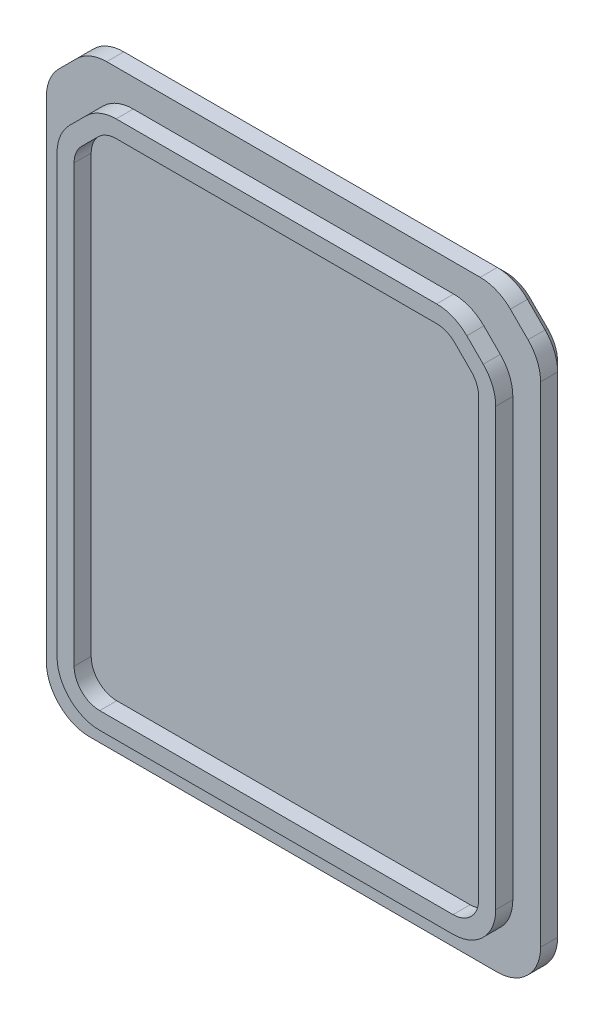
from build123d import *

# Parameters (mm, degrees)
BOSS_EXTRUDE1_DEPTH = 3
BOSS_EXTRUDE2_DEPTH = 2
CHAMFER1_SIZE       = 1
FILLET1_R           = 3
FILLET2_R           = 5


with BuildPart() as part:
    # Sketch2 → Boss-Extrude1 (new body)
    with BuildSketch(Plane(origin=(0, 0, -21.645), x_dir=(-1, 0, 0), z_dir=(0, 0, -1))):
        with BuildLine():
            Line((21.428932188, 45.48), (-22.307932188, 45.48))
            ThreePointArc((-22.307932188, 45.48), (-24.22134935, 45.099397663), (-25.843466094, 44.015533906))
            Line((-25.843466094, 44.015533906), (-27.914533906, 41.944466094))
            ThreePointArc((-27.914533906, 41.944466094), (-28.998397663, 40.32234935), (-29.379, 38.408932188))
            Line((-29.379, 38.408932188), (-29.379, -18.928932188))
            ThreePointArc((-29.379, -18.928932188), (-28.998397663, -20.84234935), (-27.914533906, -22.464466094))
            Line((-27.914533906, -22.464466094), (-27.843466094, -22.535533906))
            ThreePointArc((-27.843466094, -22.535533906), (-26.22134935, -23.619397663), (-24.307932188, -24))
            Line((-24.307932188, -24), (23.428932188, -24))
            ThreePointArc((23.428932188, -24), (25.34234935, -23.619397663), (26.964466094, -22.535533906))
            Line((26.964466094, -22.535533906), (27.035533906, -22.464466094))
            ThreePointArc((27.035533906, -22.464466094), (28.119397663, -20.84234935), (28.5, -18.928932188))
            Line((28.5, -18.928932188), (28.5, 38.408932188))
            ThreePointArc((28.5, 38.408932188), (28.119397663, 40.32234935), (27.035533906, 41.944466094))
            Line((27.035533906, 41.944466094), (24.964466094, 44.015533906))
            ThreePointArc((24.964466094, 44.015533906), (23.34234935, 45.099397663), (21.428932188, 45.48))
        make_face()
    extrude(amount=BOSS_EXTRUDE1_DEPTH)

    # Sketch3 → Boss-Extrude2 (add)
    with BuildSketch(Plane(origin=(0, 0, -21.645), x_dir=(-1, 0, 0), z_dir=(0, 0, -1))):
        Polygon((-26.129, -20.75), (25.25, -20.75), (25.25, 37.376446609), (20.396446609, 42.23), (-21.275446609, 42.23), (-26.129, 37.376446609), align=None)
        Polygon((-24.129, -18.75), (23.25, -18.75), (23.25, 36.548019485), (19.568019485, 40.23), (-20.447019485, 40.23), (-24.129, 36.548019485), align=None, mode=Mode.SUBTRACT)
    extrude(amount=-BOSS_EXTRUDE2_DEPTH)

    # Chamfer1
    chamfer1_edges = [part.edges().sort_by_distance(p)[0] for p in [
        (-26, 42.98, -24.645),
        (-28.119397663, 40.32234935, -24.645),
        (-28.5, 9.74, -24.645),
        (-28.119397663, -20.84234935, -24.645),
        (-27, -22.5, -24.645),
        (-25.34234935, -23.619397663, -24.645),
        (0.4395, -24, -24.645),
        (26.22134935, -23.619397663, -24.645),
        (27.879, -22.5, -24.645),
        (28.998397663, -20.84234935, -24.645),
        (29.379, 9.74, -24.645),
        (28.998397663, 40.32234935, -24.645),
        (26.879, 42.98, -24.645),
        (24.22134935, 45.099397663, -24.645),
        (0.4395, 45.48, -24.645),
        (-23.34234935, 45.099397663, -24.645),
    ]]
    chamfer(chamfer1_edges, length=CHAMFER1_SIZE)

    # Fillet1
    fillet1_edges = [part.edges().sort_by_distance(p)[0] for p in [
        (-19.568019485, 40.23, -20.645),
        (-23.25, 36.548019485, -20.645),
        (24.129, 36.548019485, -20.645),
        (20.447019485, 40.23, -20.645),
        (24.129, -18.75, -20.645),
        (-23.25, -18.75, -20.645),
    ]]
    fillet(fillet1_edges, radius=FILLET1_R)

    # Fillet2
    fillet2_edges = [part.edges().sort_by_distance(p)[0] for p in [
        (-25.25, 37.376446609, -20.645),
        (-20.396446609, 42.23, -20.645),
        (21.275446609, 42.23, -20.645),
        (26.129, 37.376446609, -20.645),
        (-25.25, -20.75, -20.645),
        (26.129, -20.75, -20.645),
    ]]
    fillet(fillet2_edges, radius=FILLET2_R)


solid = part.part
